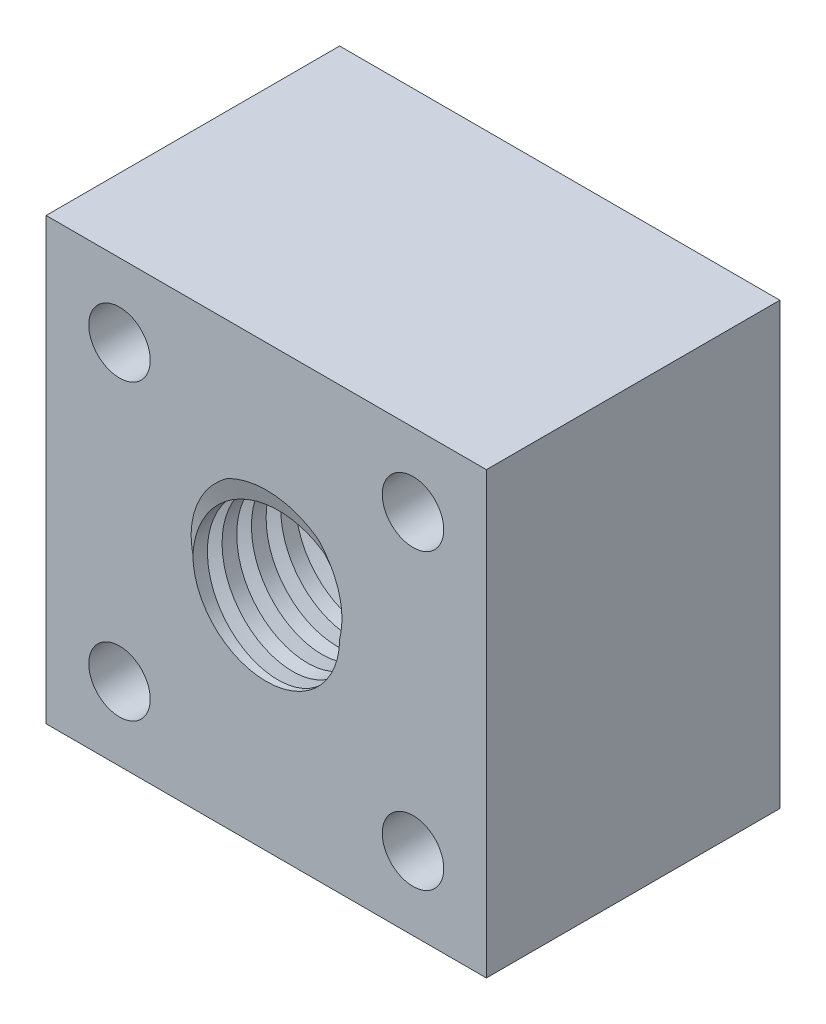
from build123d import *

# Parameters (mm, degrees)
SKETCH1_W           = 30
SKETCH1_H           = 30
SKETCH1_R           = 2.094197499
SKETCH1_R_2         = 5
BOSS_EXTRUDE1_DEPTH = 20
CUT_SWEEP1_PITCH    = 2


with BuildPart() as part:
    # Sketch1 → Boss-Extrude1 (new body)
    with BuildSketch(Plane.XY):
        Rectangle(SKETCH1_W, SKETCH1_H)
        with Locations((-10, 10)):
            Circle(SKETCH1_R, mode=Mode.SUBTRACT)
        with Locations((10, 10)):
            Circle(SKETCH1_R, mode=Mode.SUBTRACT)
        with Locations((10, -10)):
            Circle(SKETCH1_R, mode=Mode.SUBTRACT)
        with Locations((-10, -10)):
            Circle(SKETCH1_R, mode=Mode.SUBTRACT)
        Circle(SKETCH1_R_2, mode=Mode.SUBTRACT)
    extrude(amount=BOSS_EXTRUDE1_DEPTH)

    # Cut-Sweep1: arcs per turn and ends read off the stored shape
    # Cut-Sweep1: the profile of Sketch4 profile screwed along a right-hand helix through 10.75 turns, 10 arcs to a turn; built about Z, then put on its axis
    cut_sweep1_z = Axis((0, 0, 0), (0, 0, 1))
    cut_sweep1_corners = [(4.9997, 0, -2.000073687), (4.9997, 0, -0.999912842), (6.25, 0, -1.363158571), (6.25, 0, -1.692970552)]
    with BuildLine(mode=Mode.PRIVATE) as cut_sweep1_profile:
        Line(cut_sweep1_corners[0], cut_sweep1_corners[1])
        Line(cut_sweep1_corners[1], cut_sweep1_corners[2])
        Line(cut_sweep1_corners[3], cut_sweep1_corners[0])
        ThreePointArc((6.25, 0, -1.363158571), (6.299388719, 0, -1.528064561), (6.25, 0, -1.692970552))
    cut_sweep1_cap = Face(cut_sweep1_profile.wire())
    cut_sweep1_arcs = [((6.25, 0, -1.363158571), (6.358510621, 0, -1.528064561), (6.25, 0, -1.692970552), (1, 0.8353709375450658, 1))]  # start, shoulder, end, weights
    cut_sweep1_turn_angles = [0, 18, 36, 54, 72, 90, 108, 126, 144, 162, 180, 198, 216, 234, 252, 270, 288, 306, 324, 342, 360]
    cut_sweep1_turn_weights = [1, 0.9510565162951535, 1, 0.9510565162951535, 1, 0.9510565162951535, 1, 0.9510565162951535, 1, 0.9510565162951535, 1, 0.9510565162951535, 1, 0.9510565162951535, 1, 0.9510565162951535, 1, 0.9510565162951535, 1, 0.9510565162951535, 1]
    cut_sweep1_turn_rails = [Edge.make_bspline([Vector(p[0], p[1], 0).rotate(cut_sweep1_z, cut_sweep1_turn_angles[k]) / cut_sweep1_turn_weights[k] + Vector(0, 0, p[2] + CUT_SWEEP1_PITCH * cut_sweep1_turn_angles[k] / 360) for k in range(21)], [0, 0, 0, 1, 1, 2, 2, 3, 3, 4, 4, 5, 5, 6, 6, 7, 7, 8, 8, 9, 9, 10, 10, 10], 2, cut_sweep1_turn_weights) for p in cut_sweep1_corners]
    cut_sweep1_turn_sides = [*[Face.make_surface_from_curves(cut_sweep1_turn_rails[p[0]], cut_sweep1_turn_rails[p[1]]) for p in [(0, 1), (1, 2), (3, 0)]], *[Face.make_bezier_surface([[Vector(p[j][0], p[j][1], 0).rotate(cut_sweep1_z, cut_sweep1_turn_angles[2 * i + k]) / cut_sweep1_turn_weights[2 * i + k] + Vector(0, 0, p[j][2] + CUT_SWEEP1_PITCH * cut_sweep1_turn_angles[2 * i + k] / 360) for k in range(3)] for j in range(3)], [[p[3][j] * cut_sweep1_turn_weights[2 * i + k] for k in range(3)] for j in range(3)]) for p in cut_sweep1_arcs for i in range(10)]]
    cut_sweep1_last_angles = [3600, 3618, 3636, 3654, 3672, 3690, 3708, 3726, 3744, 3762, 3780, 3798, 3816, 3834, 3852, 3861, 3870]
    cut_sweep1_last_weights = [1, 0.9510565162951535, 1, 0.9510565162951535, 1, 0.9510565162951535, 1, 0.9510565162951535, 1, 0.9510565162951535, 1, 0.9510565162951535, 1, 0.9510565162951535, 1, 0.9876883405951452, 1]
    cut_sweep1_last_rails = [Edge.make_bspline([Vector(p[0], p[1], 0).rotate(cut_sweep1_z, cut_sweep1_last_angles[k]) / cut_sweep1_last_weights[k] + Vector(0, 0, p[2] + CUT_SWEEP1_PITCH * cut_sweep1_last_angles[k] / 360) for k in range(17)], [0, 0, 0, 1, 1, 2, 2, 3, 3, 4, 4, 5, 5, 6, 6, 7, 7, 8, 8, 8], 2, cut_sweep1_last_weights) for p in cut_sweep1_corners]
    cut_sweep1_last_sides = [*[Face.make_surface_from_curves(cut_sweep1_last_rails[p[0]], cut_sweep1_last_rails[p[1]]) for p in [(0, 1), (1, 2), (3, 0)]], *[Face.make_bezier_surface([[Vector(p[j][0], p[j][1], 0).rotate(cut_sweep1_z, cut_sweep1_last_angles[2 * i + k]) / cut_sweep1_last_weights[2 * i + k] + Vector(0, 0, p[j][2] + CUT_SWEEP1_PITCH * cut_sweep1_last_angles[2 * i + k] / 360) for k in range(3)] for j in range(3)], [[p[3][j] * cut_sweep1_last_weights[2 * i + k] for k in range(3)] for j in range(3)]) for p in cut_sweep1_arcs for i in range(8)]]
    cut_sweep1 = Plane(origin=(0, 0, 20), x_dir=(1, 0, 0), z_dir=(0, 0, -1)) * Solid(Shell([*[p.moved(Location((0, 0, CUT_SWEEP1_PITCH * i))) for i in range(10) for p in cut_sweep1_turn_sides], *cut_sweep1_last_sides, cut_sweep1_cap, cut_sweep1_cap.rotate(cut_sweep1_z, 3870).moved(Location((0, 0, CUT_SWEEP1_PITCH * 3870 / 360)))]))
    add(cut_sweep1, mode=Mode.SUBTRACT)


solid = part.part
